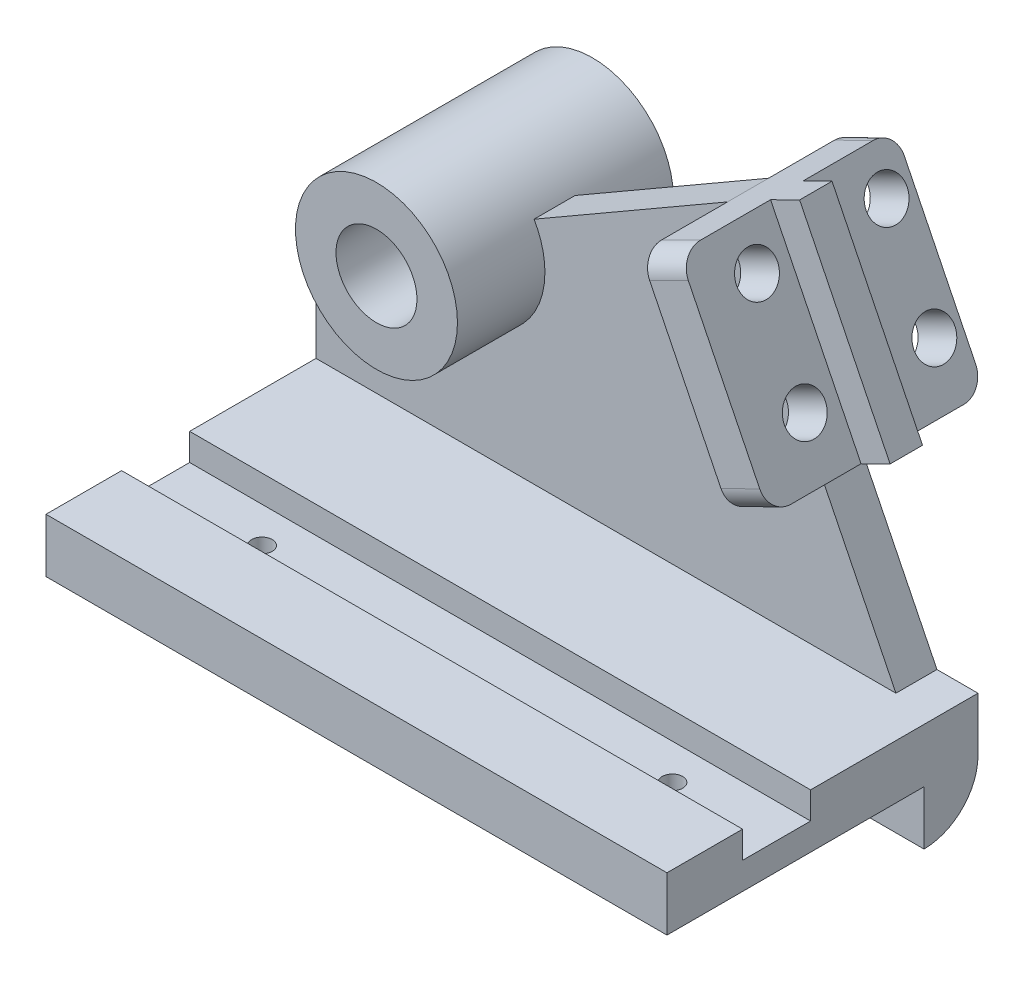
from build123d import *

# Parameters (mm, degrees)
BOSS_EXTRUDE1_DEPTH      = 57.5
FILLET1_R                = 5
BOSS_EXTRUDE2_DEPTH      = 3.8
BOSS_EXTRUDE3_DEPTH      = 8.1
BOSS_EXTRUDE3_DEPTH_BACK = 11.9
SKETCH3_R                = 7.5
HOLE1_D                  = 7.5
BOSS_EXTRUDE4_DEPTH      = 8.1
BOSS_EXTRUDE4_DEPTH_BACK = 11.9
SKETCH7_W                = 3
SKETCH7_H                = 18.938620175
BOSS_EXTRUDE5_DEPTH      = 3
HOLE2_D                  = 3.8
HOLE2_DEPTH              = 4
FILLET2_R                = 2
HOLE3_D                  = 1.9
LPATTERN1_COUNT          = 2
LPATTERN1_PITCH          = 38


with BuildPart() as part:
    # Sketch1 → Boss-Extrude1 (new body)
    with BuildSketch(Plane(origin=(0, 0, 0), x_dir=(0, 0, -1), z_dir=(1, 0, 0))):
        Polygon((0, 5), (0, 10), (7, 10), (7, 7.5), (13.3, 7.5), (13.3, 10), (28.8, 10), (28.8, 0), (23.8, 0), (23.8, 5), align=None)
    extrude(amount=BOSS_EXTRUDE1_DEPTH)

    # Fillet1
    fillet1_edges = [part.edges().sort_by_distance(p)[0] for p in [
        (28.75, 0, -28.8),
    ]]
    fillet(fillet1_edges, radius=FILLET1_R - 0.0001)  # a hair under: the kernel refuses the full size

    # Sketch2 → Boss-Extrude2 (add)
    with BuildSketch(Plane(origin=(0, 0, -28.8), x_dir=(-1, 0, 0), z_dir=(0, 0, -1))):
        Polygon((-53.7, 10), (0, 10), (0, 19.6), (-38.105117767, 41.6), align=None)
    extrude(amount=-BOSS_EXTRUDE2_DEPTH)

    # Sketch3 → Boss-Extrude3 (add, two sides: drawn at the far end of the back side and taken through both)
    with BuildSketch(Plane.XY.offset(-25).offset(-BOSS_EXTRUDE3_DEPTH_BACK)):
        with Locations((13.7, 27.509698688)):
            Circle(SKETCH3_R)
    extrude(amount=BOSS_EXTRUDE3_DEPTH + BOSS_EXTRUDE3_DEPTH_BACK)

    # Hole1 (through all)
    with Locations(Plane.XY.offset(-16.9)):
        with Locations((13.7, 27.509698688)):
            Hole(HOLE1_D / 2)

    # Sketch6 → Boss-Extrude4 (add, two sides: drawn at the far end of the back side and taken through both)
    with BuildSketch(Plane.XY.offset(-25).offset(-BOSS_EXTRUDE4_DEPTH_BACK)):
        Polygon((38.105117767, 41.6), (41.692091359, 43.370203505), (50.073394311, 26.387120893), (46.486420719, 24.616917389), align=None)
    extrude(amount=BOSS_EXTRUDE4_DEPTH + BOSS_EXTRUDE4_DEPTH_BACK)

    # Sketch7 → Boss-Extrude5 (add)
    with BuildSketch(Plane(origin=(50.738305729, 25.039807043, 0), x_dir=(0, 0, -1), z_dir=(0.8967433980837525, 0.44255087616363914, 0))):
        with Locations((26.9, 10.971762018)):
            Rectangle(SKETCH7_W, SKETCH7_H)
    extrude(amount=BOSS_EXTRUDE5_DEPTH)

    # Hole2
    with Locations(Plane(origin=(50.738305729, 25.039807043, 0), x_dir=(0, 0, -1), z_dir=(0.8967433980837525, 0.44255087616363914, 0))):
        with Locations((34.4, 6.502451931), (22.4, 6.502451931), (22.4, 16.502451931), (34.4, 16.502451931)):
            Hole(HOLE2_D / 2, depth=HOLE2_DEPTH)

    # Fillet2
    fillet2_edges = [part.edges().sort_by_distance(p)[0] for p in [
        (39.898604563, 42.485101752, -36.9),
        (48.279907515, 25.502019141, -36.9),
        (48.279907515, 25.502019141, -16.9),
        (39.898604563, 42.485101752, -16.9),
    ]]
    fillet(fillet2_edges, radius=FILLET2_R)

    # Hole3 (through all)
    with Locations(Plane(origin=(0, 7.5, 0), x_dir=(1, 0, 0), z_dir=(0, 1, 0))):
        with Locations((10, 10)):
            hole3 = Hole(HOLE3_D / 2)

    # LPattern1: Hole3 ×2
    with Locations(*[(i * LPATTERN1_PITCH, 0, 0) for i in range(1, LPATTERN1_COUNT)]):
        add(hole3, mode=Mode.SUBTRACT)


solid = part.part
